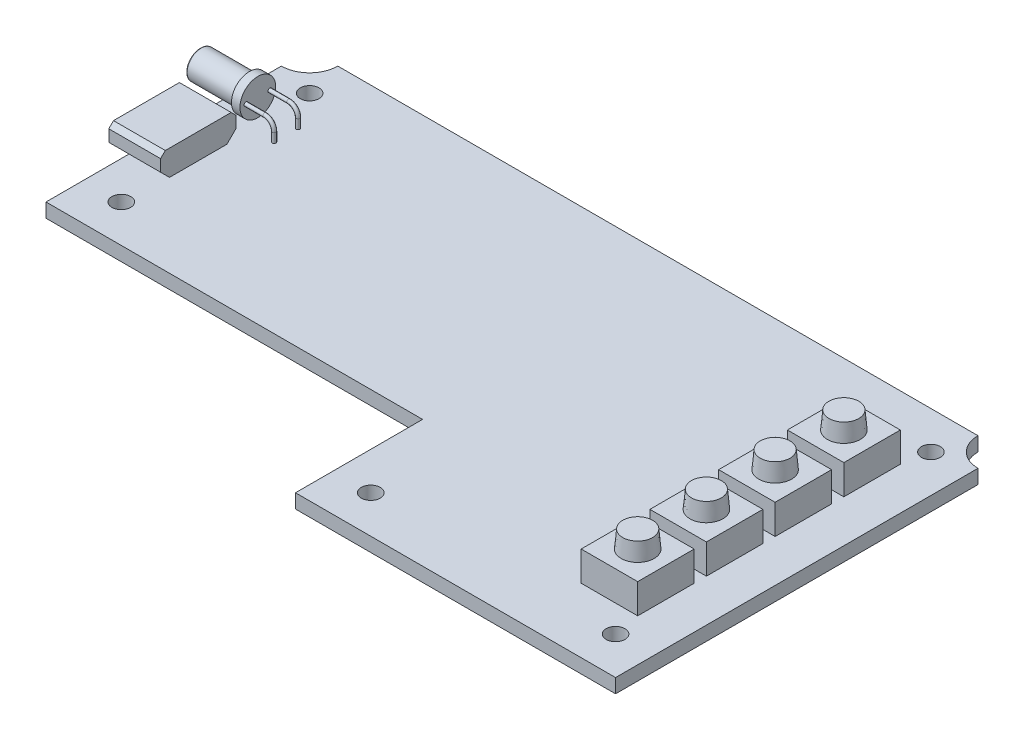
from build123d import *

# Parameters (mm, degrees)
SKETCH_1_R                = 1
EXTRUDE_1_DEPTH           = 1.5
SKETCH_2_W                = 6
SKETCH_2_H                = 6
EXTRUDE_2_DEPTH           = 3.15
SKETCH_3_R                = 1.75
EXTRUDE_3_DEPTH           = 1.85
EXTRUDE_3_DRAFT           = 5
EXTRUDE_3_PROFILE_2_DEPTH = 1.85
EXTRUDE_3_PROFILE_2_DRAFT = 5
EXTRUDE_3_PROFILE_3_DEPTH = 1.85
EXTRUDE_3_PROFILE_3_DRAFT = 5
EXTRUDE_3_PROFILE_4_DEPTH = 1.85
EXTRUDE_3_PROFILE_4_DRAFT = 5
SKETCH_4_W                = 5.5
SKETCH_4_H                = 8
EXTRUDE_4_DEPTH           = 2.4
EXTRUDE_5_REACH           = 80.763
SKETCH_5_W                = 8
SKETCH_5_H                = 3
CHAMFER_1_SIZE            = 0.5
SKETCH_6_R                = 0.2
SKETCH_8_R                = 1.9
EXTRUDE_6_DEPTH           = 0.9
SKETCH_9_R                = 1.5
EXTRUDE_7_DEPTH           = 5.2
CUT_EXTRUDE_1_DEPTH       = 4
EXTRUDE_8_DEPTH           = 3
FILLET_1_R                = 0.1


with BuildPart() as part:
    # Эскиз1 → Бобышка-Вытянуть1 (new body)
    with BuildSketch(Plane(origin=(0, 0, 0), x_dir=(1, 0, 0), z_dir=(0, 1, 0))):
        with BuildLine():
            Line((-37, -9), (3, -9))
            Line((3, -9), (3, -22.5))
            Line((3, -22.5), (37, -22.5))
            Line((37, -22.5), (37, 16))
            ThreePointArc((37, 16), (34.878679656, 16.878679656), (34, 19))
            Line((34, 19), (-34, 19))
            ThreePointArc((-34, 19), (-34.878679656, 16.878679656), (-37, 16))
            Line((-37, 16), (-37, -9))
        make_face()
        with Locations(Location((-33, -5, 0), (0, 0, 270))):
            Circle(SKETCH_1_R, mode=Mode.SUBTRACT)
        with Locations(Location((33, -18.5, 0), (0, 0, 270))):
            Circle(SKETCH_1_R, mode=Mode.SUBTRACT)
        with Locations(Location((7, -18.5, 0), (0, 0, 270))):
            Circle(SKETCH_1_R, mode=Mode.SUBTRACT)
        with Locations(Location((-33, 15, 0), (0, 0, 270))):
            Circle(SKETCH_1_R, mode=Mode.SUBTRACT)
        with Locations(Location((33, 15, 0), (0, 0, 270))):
            Circle(SKETCH_1_R, mode=Mode.SUBTRACT)
    extrude(amount=EXTRUDE_1_DEPTH)

    # Эскиз2 → Бобышка-Вытянуть2 (add)
    with BuildSketch(Plane(origin=(0, 1.5, 0), x_dir=(1, 0, 0), z_dir=(0, 1, 0))):
        with Locations((29.5, 1.95)):
            Rectangle(SKETCH_2_W, SKETCH_2_H)
        with Locations((29.5, 9.25)):
            Rectangle(SKETCH_2_W, SKETCH_2_H)
        with Locations((29.5, -5.35)):
            Rectangle(SKETCH_2_W, SKETCH_2_H)
        with Locations((29.5, -12.65)):
            Rectangle(SKETCH_2_W, SKETCH_2_H)
    extrude(amount=EXTRUDE_2_DEPTH)


with BuildPart() as extrude_3_tool:
    # Эскиз3 → Бобышка-Вытянуть3 (with draft: the straight prism first)
    with BuildSketch(Plane(origin=(0, 4.65, 0), x_dir=(1, 0, 0), z_dir=(0, 1, 0))):
        with Locations((29.5, 9.25)):
            Circle(SKETCH_3_R)
    extrude(amount=EXTRUDE_3_DEPTH)
    # Бобышка-Вытянуть3: the draft: its side faces are tilted about the plane it starts from
    extrude_3_sides = [extrude_3_tool.faces().sort_by_distance(p)[0] for p in [
        (27.75, 5.575, -9.25),
    ]]
    draft(extrude_3_sides, Plane(origin=(0, 4.65, 0), x_dir=(1, 0, 0), z_dir=(0, 1, 0)), EXTRUDE_3_DRAFT)


with BuildPart() as part_1:
    add(part.part)

    # Бобышка-Вытянуть3: add extrude_3_tool
    add(extrude_3_tool.part)


with BuildPart() as extrude_3_profile_2_tool:
    # Эскиз3 → Бобышка-Вытянуть3 profile 2 (with draft: the straight prism first)
    with BuildSketch(Plane(origin=(0, 4.65, 0), x_dir=(1, 0, 0), z_dir=(0, 1, 0))):
        with Locations((29.5, 1.95)):
            Circle(SKETCH_3_R)
    extrude(amount=EXTRUDE_3_PROFILE_2_DEPTH)
    # Бобышка-Вытянуть3 profile 2: the draft: its side faces are tilted about the plane it starts from
    extrude_3_profile_2_sides = [extrude_3_profile_2_tool.faces().sort_by_distance(p)[0] for p in [
        (27.75, 5.575, -1.95),
    ]]
    draft(extrude_3_profile_2_sides, Plane(origin=(0, 4.65, 0), x_dir=(1, 0, 0), z_dir=(0, 1, 0)), EXTRUDE_3_PROFILE_2_DRAFT)


with BuildPart() as part_2:
    add(part_1.part)

    # Бобышка-Вытянуть3 profile 2: add extrude_3_profile_2_tool
    add(extrude_3_profile_2_tool.part)


with BuildPart() as extrude_3_profile_3_tool:
    # Эскиз3 → Бобышка-Вытянуть3 profile 3 (with draft: the straight prism first)
    with BuildSketch(Plane(origin=(0, 4.65, 0), x_dir=(1, 0, 0), z_dir=(0, 1, 0))):
        with Locations((29.5, -5.35)):
            Circle(SKETCH_3_R)
    extrude(amount=EXTRUDE_3_PROFILE_3_DEPTH)
    # Бобышка-Вытянуть3 profile 3: the draft: its side faces are tilted about the plane it starts from
    extrude_3_profile_3_sides = [extrude_3_profile_3_tool.faces().sort_by_distance(p)[0] for p in [
        (27.75, 5.575, 5.35),
    ]]
    draft(extrude_3_profile_3_sides, Plane(origin=(0, 4.65, 0), x_dir=(1, 0, 0), z_dir=(0, 1, 0)), EXTRUDE_3_PROFILE_3_DRAFT)


with BuildPart() as part_3:
    add(part_2.part)

    # Бобышка-Вытянуть3 profile 3: add extrude_3_profile_3_tool
    add(extrude_3_profile_3_tool.part)


with BuildPart() as extrude_3_profile_4_tool:
    # Эскиз3 → Бобышка-Вытянуть3 profile 4 (with draft: the straight prism first)
    with BuildSketch(Plane(origin=(0, 4.65, 0), x_dir=(1, 0, 0), z_dir=(0, 1, 0))):
        with Locations((29.5, -12.65)):
            Circle(SKETCH_3_R)
    extrude(amount=EXTRUDE_3_PROFILE_4_DEPTH)
    # Бобышка-Вытянуть3 profile 4: the draft: its side faces are tilted about the plane it starts from
    extrude_3_profile_4_sides = [extrude_3_profile_4_tool.faces().sort_by_distance(p)[0] for p in [
        (27.75, 5.575, 12.65),
    ]]
    draft(extrude_3_profile_4_sides, Plane(origin=(0, 4.65, 0), x_dir=(1, 0, 0), z_dir=(0, 1, 0)), EXTRUDE_3_PROFILE_4_DRAFT)


with BuildPart() as part_4:
    add(part_3.part)

    # Бобышка-Вытянуть3 profile 4: add extrude_3_profile_4_tool
    add(extrude_3_profile_4_tool.part)

    # Эскиз4 → Бобышка-Вытянуть4 (add)
    with BuildSketch(Plane(origin=(0, 1.5, 0), x_dir=(1, 0, 0), z_dir=(0, 1, 0))):
        with Locations((-35.45, 2.87)):
            Rectangle(SKETCH_4_W, SKETCH_4_H)
    extrude(amount=EXTRUDE_4_DEPTH)

    # Бобышка-Вытянуть5: up to this face of the body (flat: up to its plane)
    extrude_5_end = Plane(part_4.part.faces().sort_by_distance((-32.7, 2.7, -2.87))[0])
    # Эскиз5 → Бобышка-Вытянуть5 (add, up to the picked face)
    with BuildSketch(Plane.ZY.offset(38.2), mode=Mode.PRIVATE) as extrude_5_sk1:
        with Locations((-2.87, 2.7)):
            Rectangle(SKETCH_5_W, SKETCH_5_H)
    extrude_5_tool1 = split(extrude(extrude_5_sk1.sketch, amount=-EXTRUDE_5_REACH, mode=Mode.PRIVATE), bisect_by=extrude_5_end, keep=Keep.BOTH, mode=Mode.PRIVATE)
    add(extrude_5_tool1.solids().sort_by(Axis((-38.2, 2.7, -2.87), (1, 0, 0)))[0])

    # Фаска1
    chamfer_1_edges = [part_4.edges().sort_by_distance(p)[0] for p in [
        (-35.45, 4.2, -6.87),
        (-35.45, 4.2, 1.13),
    ]]
    chamfer(chamfer_1_edges, length=CHAMFER_1_SIZE)

    # Фаска2
    # the kernel refuses this chamfer: 1.25 mm, written as the material it takes off along each edge
    with BuildSketch(Plane(origin=(-45.915048964, 1.2, 1.13), x_dir=(0, -0.02749587661058649, -0.9996219169112968), z_dir=(1, 0, 0))) as chamfer_2_piece_1_section:
        with BuildLine():
            Line((1.285841494, 0), (-0.070683944, 1.283897242))
            Line((-0.070683944, 1.283897242), (-0.095674492, 1.283209845))
            ThreePointArc((-0.095674492, 1.283209845), (-0.042661534, 0.641747287), (-0.024990548, -0.000687397))
            Line((-0.024990548, -0.000687397), (0.000687397, -0.024990548))
            ThreePointArc((0.000687397, -0.024990548), (0.643122081, -0.007319562), (1.286528891, -0.024990548))
            Line((1.286528891, -0.024990548), (1.285841494, 0))
        make_face()
    chamfer_2_piece_1 = extrude(amount=8.915048964, mode=Mode.PRIVATE)
    chamfer_2_piece_1 = split(chamfer_2_piece_1, bisect_by=Plane(origin=(-41.457524482, 1.5, 0.565873804), z_dir=(0, -1, 0)), keep=Keep.TOP, mode=Mode.PRIVATE)
    add(chamfer_2_piece_1, mode=Mode.SUBTRACT)
    with BuildSketch(Plane(origin=(-45.915048964, 1.2, 1.13), x_dir=(0, -0.02749587661058649, -0.9996219169112968), z_dir=(1, 0, 0))) as chamfer_2_piece_2_section:
        with BuildLine():
            Line((1.285841494, 0), (-0.070683944, 1.283897242))
            Line((-0.070683944, 1.283897242), (-0.095674492, 1.283209845))
            ThreePointArc((-0.095674492, 1.283209845), (-0.042661534, 0.641747287), (-0.024990548, -0.000687397))
            Line((-0.024990548, -0.000687397), (0.000687397, -0.024990548))
            ThreePointArc((0.000687397, -0.024990548), (0.643122081, -0.007319562), (1.286528891, -0.024990548))
            Line((1.286528891, -0.024990548), (1.285841494, 0))
        make_face()
    chamfer_2_piece_2 = extrude(amount=8.915048964, mode=Mode.PRIVATE)
    chamfer_2_piece_2 = split(chamfer_2_piece_2, bisect_by=Plane(origin=(-41.457524482, 1.5, 0.835841418), z_dir=(0, 1, 0)), keep=Keep.TOP, mode=Mode.PRIVATE)
    add(chamfer_2_piece_2, mode=Mode.SUBTRACT)
    with BuildSketch(Plane(origin=(-45.915048964, 1.2, 1.13), x_dir=(0, -0.02749587661058649, -0.9996219169112968), z_dir=(1, 0, 0))) as chamfer_2_piece_3_section:
        with BuildLine():
            Line((1.285841494, 0), (-0.070683944, 1.283897242))
            Line((-0.070683944, 1.283897242), (-0.095674492, 1.283209845))
            ThreePointArc((-0.095674492, 1.283209845), (-0.042661534, 0.641747287), (-0.024990548, -0.000687397))
            Line((-0.024990548, -0.000687397), (0.000687397, -0.024990548))
            ThreePointArc((0.000687397, -0.024990548), (0.643122081, -0.007319562), (1.286528891, -0.024990548))
            Line((1.286528891, -0.024990548), (1.285841494, 0))
        make_face()
    chamfer_2_piece_3 = extrude(amount=16.630097928, mode=Mode.PRIVATE)
    chamfer_2_piece_3 = split(chamfer_2_piece_3, bisect_by=Plane(origin=(-37, 1.834493802, 0.835841418), z_dir=(1, 0, 0)), keep=Keep.TOP, mode=Mode.PRIVATE)
    chamfer_2_piece_3 = split(chamfer_2_piece_3, bisect_by=Plane(origin=(-33.142475518, 1.5, 0.835841418), z_dir=(0, 1, 0)), keep=Keep.TOP, mode=Mode.PRIVATE)
    add(chamfer_2_piece_3, mode=Mode.SUBTRACT)
    with BuildSketch(Plane(origin=(-45.915048964, 1.2, -6.87), x_dir=(0, 0.9996219169112968, -0.027495876610586317), z_dir=(1, 0, 0))) as chamfer_2_piece_4_section:
        with BuildLine():
            Line((1.285841494, 0), (-0.070683944, 1.283897242))
            Line((-0.070683944, 1.283897242), (-0.095674492, 1.283209845))
            ThreePointArc((-0.095674492, 1.283209845), (-0.042661534, 0.641747287), (-0.024990548, -0.000687397))
            Line((-0.024990548, -0.000687397), (0.000687397, -0.024990548))
            ThreePointArc((0.000687397, -0.024990548), (0.643122081, -0.007319562), (1.286528891, -0.024990548))
            Line((1.286528891, -0.024990548), (1.285841494, 0))
        make_face()
    chamfer_2_piece_4 = extrude(amount=8.915048964, mode=Mode.PRIVATE)
    chamfer_2_piece_4 = split(chamfer_2_piece_4, bisect_by=Plane(origin=(-41.457524482, 1.5, -6.575841418), z_dir=(0, 1, 0)), keep=Keep.TOP, mode=Mode.PRIVATE)
    add(chamfer_2_piece_4, mode=Mode.SUBTRACT)
    with BuildSketch(Plane(origin=(-45.915048964, 1.2, -6.87), x_dir=(0, 0.9996219169112968, -0.027495876610586317), z_dir=(1, 0, 0))) as chamfer_2_piece_5_section:
        with BuildLine():
            Line((1.285841494, 0), (-0.070683944, 1.283897242))
            Line((-0.070683944, 1.283897242), (-0.095674492, 1.283209845))
            ThreePointArc((-0.095674492, 1.283209845), (-0.042661534, 0.641747287), (-0.024990548, -0.000687397))
            Line((-0.024990548, -0.000687397), (0.000687397, -0.024990548))
            ThreePointArc((0.000687397, -0.024990548), (0.643122081, -0.007319562), (1.286528891, -0.024990548))
            Line((1.286528891, -0.024990548), (1.285841494, 0))
        make_face()
    chamfer_2_piece_5 = extrude(amount=8.915048964, mode=Mode.PRIVATE)
    chamfer_2_piece_5 = split(chamfer_2_piece_5, bisect_by=Plane(origin=(-41.457524482, 1.5, -6.305873804), z_dir=(0, -1, 0)), keep=Keep.TOP, mode=Mode.PRIVATE)
    add(chamfer_2_piece_5, mode=Mode.SUBTRACT)
    with BuildSketch(Plane(origin=(-45.915048964, 1.2, -6.87), x_dir=(0, 0.9996219169112968, -0.027495876610586317), z_dir=(1, 0, 0))) as chamfer_2_piece_6_section:
        with BuildLine():
            Line((1.285841494, 0), (-0.070683944, 1.283897242))
            Line((-0.070683944, 1.283897242), (-0.095674492, 1.283209845))
            ThreePointArc((-0.095674492, 1.283209845), (-0.042661534, 0.641747287), (-0.024990548, -0.000687397))
            Line((-0.024990548, -0.000687397), (0.000687397, -0.024990548))
            ThreePointArc((0.000687397, -0.024990548), (0.643122081, -0.007319562), (1.286528891, -0.024990548))
            Line((1.286528891, -0.024990548), (1.285841494, 0))
        make_face()
    chamfer_2_piece_6 = extrude(amount=16.630097928, mode=Mode.PRIVATE)
    chamfer_2_piece_6 = split(chamfer_2_piece_6, bisect_by=Plane(origin=(-37, 1.834493802, -6.575841418), z_dir=(1, 0, 0)), keep=Keep.TOP, mode=Mode.PRIVATE)
    chamfer_2_piece_6 = split(chamfer_2_piece_6, bisect_by=Plane(origin=(-33.142475518, 1.5, -6.575841418), z_dir=(0, 1, 0)), keep=Keep.TOP, mode=Mode.PRIVATE)
    add(chamfer_2_piece_6, mode=Mode.SUBTRACT)

    # По траектории1: sweep along a path in Эскиз7
    with BuildLine(Plane.XY) as sweep_1_path:
        Line((-30.4, 1.5), (-30.4, 2.5))
        ThreePointArc((-30.4, 2.5), (-30.692893219, 3.207106781), (-31.4, 3.5))
        Line((-31.4, 3.5), (-33.4, 3.5))
    # Эскиз6 → По траектории1 (sweep)
    with BuildSketch(Plane(origin=(0, 1.5, 0), x_dir=(1, 0, 0), z_dir=(0, 1, 0))):
        with Locations((-30.4, 11.17)):
            Circle(SKETCH_6_R)
        with Locations((-30.4, 8.63)):
            Circle(SKETCH_6_R)
    sweep(path=sweep_1_path.line)

    # Эскиз8 → Бобышка-Вытянуть6 (add)
    with BuildSketch(Plane.ZY.offset(33.4)):
        with Locations((-9.9, 3.5)):
            Circle(SKETCH_8_R)
    extrude(amount=EXTRUDE_6_DEPTH)

    # Эскиз9 → Бобышка-Вытянуть7 (add)
    with BuildSketch(Plane.ZY.offset(34.3)):
        with Locations((-9.9, 3.5)):
            Circle(SKETCH_9_R)
    extrude(amount=EXTRUDE_7_DEPTH)

    # Эскиз16 → Вырез-Вытянуть1 (cut)
    with BuildSketch(Plane.ZY.offset(38.2)):
        Polygon((-6.67, 3.617157288), (-6.67, 2.532842712), (-5.537157288, 1.4), (-0.202842712, 1.4), (0.93, 2.532842712), (0.93, 3.617157288), (0.547157288, 4), (-6.287157288, 4), align=None)
    extrude(amount=-CUT_EXTRUDE_1_DEPTH, mode=Mode.SUBTRACT)

    # Эскиз17 → Бобышка-Вытянуть8 (add)
    with BuildSketch(Plane.ZY.offset(34.2)):
        Polygon((-6.27, 3.575), (-6.37, 3.475), (-6.37, 2.675), (-6.27, 2.575), (0.53, 2.575), (0.63, 2.675), (0.63, 3.475), (0.53, 3.575), align=None)
    extrude(amount=EXTRUDE_8_DEPTH)

    # Скругление1
    fillet_1_edges = [part_4.edges().sort_by_distance(p)[0] for p in [
        (-39.5, 3.5, -11.4),
    ]]
    fillet(fillet_1_edges, radius=FILLET_1_R)


solid = part_4.part
